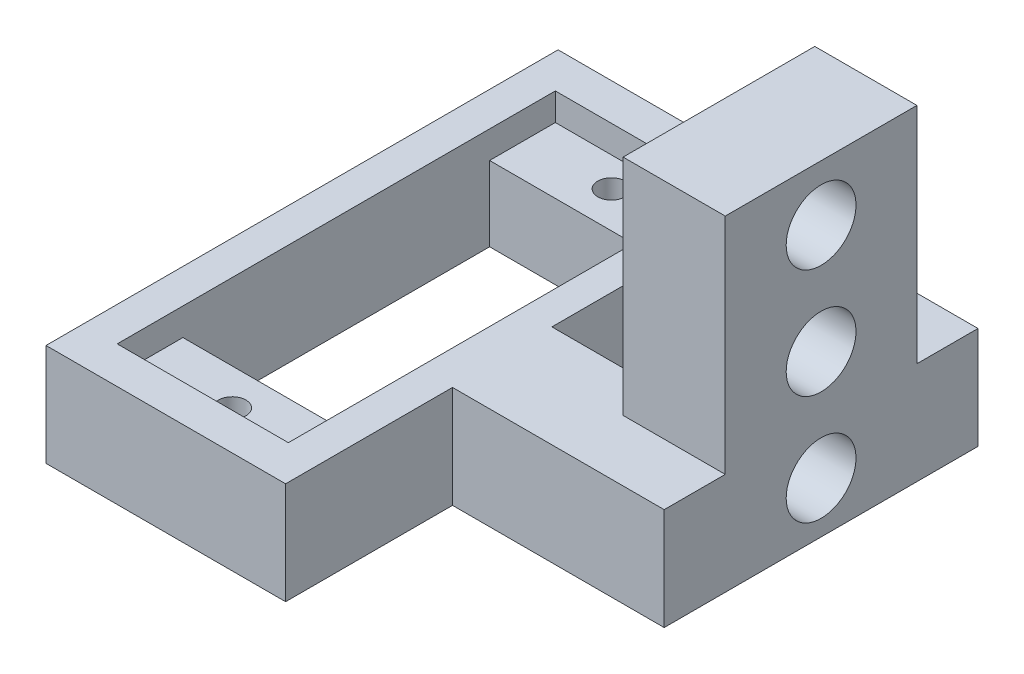
from build123d import *

# Parameters (mm, degrees)
SKETCH4_R           = 1
SKETCH4_W           = 8.2
SKETCH4_H           = 8
SKETCH4_W_2         = 12.5
SKETCH4_H_2         = 22.4
BOSS_EXTRUDE2_DEPTH = 7.46
SKETCH8_W           = 7.46
SKETCH8_H           = 14
BOSS_EXTRUDE4_DEPTH = 16.34
SKETCH9_R           = 2.55
CUT_EXTRUDE2_DEPTH  = 43.142763317
SKETCH12_W          = 12.5
SKETCH12_H          = 32
CUT_EXTRUDE5_DEPTH  = 2


with BuildPart() as part:
    # Sketch4 → Boss-Extrude2 (new body)
    with BuildSketch(Plane(origin=(0, 0, 0), x_dir=(1, 0, 0), z_dir=(0, 1, 0))):
        Polygon((8.75, 11.46), (24.21, 11.46), (24.21, -11.46), (8.75, -11.46), (8.75, -23.65), (-8.75, -23.65), (-8.75, 13.75), (8.75, 13.75), align=None)
        with Locations((0, 8.9)):
            Circle(SKETCH4_R, mode=Mode.SUBTRACT)
        with Locations((0, -18.8)):
            Circle(SKETCH4_R, mode=Mode.SUBTRACT)
        with Locations((12.65, 0)):
            Rectangle(SKETCH4_W, SKETCH4_H, mode=Mode.SUBTRACT)
        with Locations((0, -4.95)):
            Rectangle(SKETCH4_W_2, SKETCH4_H_2, mode=Mode.SUBTRACT)
    extrude(amount=BOSS_EXTRUDE2_DEPTH)

    # Sketch8 → Boss-Extrude4 (add)
    with BuildSketch(Plane(origin=(0, 7.46, 0), x_dir=(1, 0, 0), z_dir=(0, 1, 0))):
        with Locations((20.48, 0)):
            Rectangle(SKETCH8_W, SKETCH8_H)
    extrude(amount=BOSS_EXTRUDE4_DEPTH)

    # Sketch9 → Cut-Extrude2 (cut, through all)
    with BuildSketch(Plane.ZY.offset(-16.75)):
        with Locations((0, 3.73)):
            Circle(SKETCH9_R)
        with Locations((0, 11.73)):
            Circle(SKETCH9_R)
        with Locations((0, 19.73)):
            Circle(SKETCH9_R)
    extrude(amount=-CUT_EXTRUDE2_DEPTH, mode=Mode.SUBTRACT)

    # Sketch12 → Cut-Extrude5 (cut)
    with BuildSketch(Plane(origin=(0, 7.46, 0), x_dir=(1, 0, 0), z_dir=(0, 1, 0))):
        with Locations((0, -4.95)):
            Rectangle(SKETCH12_W, SKETCH12_H)
    extrude(amount=-CUT_EXTRUDE5_DEPTH, mode=Mode.SUBTRACT)


solid = part.part
